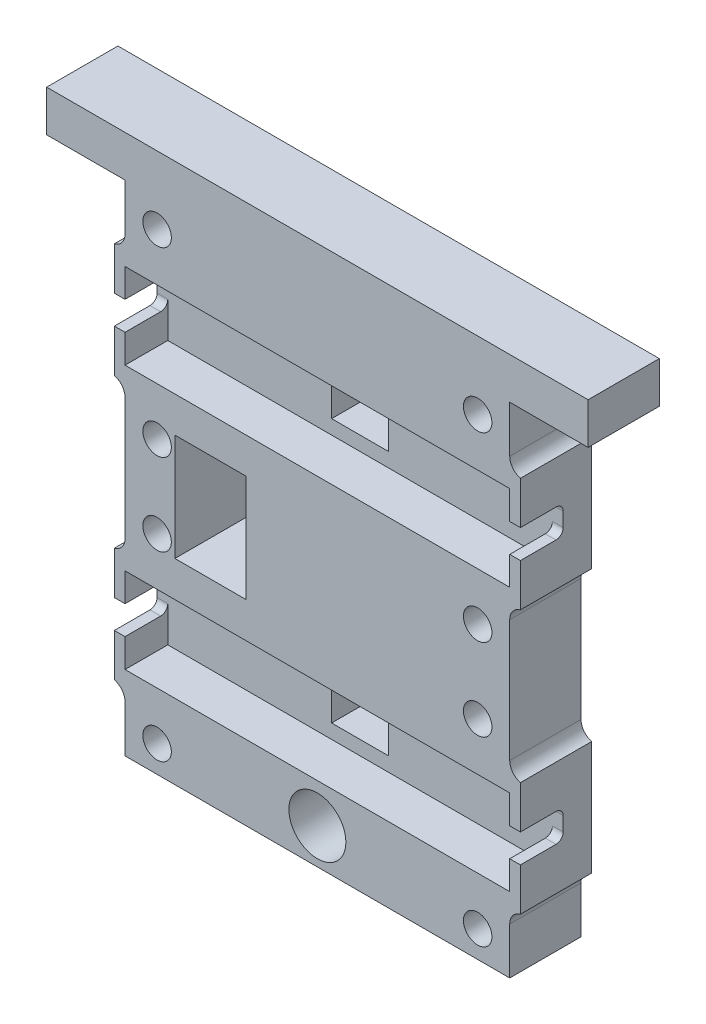
from build123d import *

# Parameters (mm, degrees)
ESBO_O1_R                = 2
ESBO_O1_R_2              = 4
RESSALTO_EXTRUS_O1_DEPTH = 10
ESBO_O7_W                = 10
ESBO_O7_H                = 15
ESBO_O7_W_2              = 8
ESBO_O7_H_2              = 8
CORTE_EXTRUS_O1_DEPTH    = 55.856129841
CORTE_EXTRUS_O7_DEPTH    = 6
FILETE1_R                = 1
FILETE2_R                = 2


with BuildPart() as part:
    # Esboço1 → Ressalto-extrusão1 (new body)
    with BuildSketch(Plane.XY):
        Polygon((-26.623119185, 32.1), (-26.623119185, 23.6), (-28.123119185, 23.6), (-28.123119185, 7.6), (-26.623119185, 7.6), (-26.623119185, -13.4), (-28.123119185, -13.4), (-28.123119185, -29.4), (-26.623119185, -29.4), (-26.623119185, -37.9), (27.376880815, -37.9), (27.376880815, -29.4), (28.876880815, -29.4), (28.876880815, -13.4), (27.376880815, -13.4), (27.376880815, 7.6), (28.876880815, 7.6), (28.876880815, 23.6), (27.376880815, 23.6), (27.376880815, 32.1), (38.376880815, 32.1), (38.376880815, 37.9), (-37.623119185, 37.9), (-37.623119185, 32.1), align=None)
        with Locations((-22.123119185, 28.35)):
            Circle(ESBO_O1_R, mode=Mode.SUBTRACT)
        with Locations((22.876880815, 28.35)):
            Circle(ESBO_O1_R, mode=Mode.SUBTRACT)
        with Locations((22.876880815, -34.15)):
            Circle(ESBO_O1_R, mode=Mode.SUBTRACT)
        with Locations((-22.123119185, -34.15)):
            Circle(ESBO_O1_R, mode=Mode.SUBTRACT)
        with Locations((-22.123119185, -8.65)):
            Circle(ESBO_O1_R, mode=Mode.SUBTRACT)
        with Locations((22.876880815, -8.65)):
            Circle(ESBO_O1_R, mode=Mode.SUBTRACT)
        with Locations((-22.123119185, 2.85)):
            Circle(ESBO_O1_R, mode=Mode.SUBTRACT)
        with Locations((22.876880815, 2.85)):
            Circle(ESBO_O1_R, mode=Mode.SUBTRACT)
        with Locations((0.376880815, -32.9)):
            Circle(ESBO_O1_R_2, mode=Mode.SUBTRACT)
    extrude(amount=RESSALTO_EXTRUS_O1_DEPTH)

    # Esboço7 → Corte-extrusão1 (cut, through all)
    with BuildSketch(Plane(origin=(0, 0, 0), x_dir=(-1, 0, 0), z_dir=(0, 0, -1))):
        with Locations((14.623119185, -2.9)):
            Rectangle(ESBO_O7_W, ESBO_O7_H)
        with Locations((-0.376880815, 15.6)):
            Rectangle(ESBO_O7_W_2, ESBO_O7_H_2)
        with Locations((-0.376880815, -21.4)):
            Rectangle(ESBO_O7_W_2, ESBO_O7_H_2)
    extrude(amount=-CORTE_EXTRUS_O1_DEPTH, mode=Mode.SUBTRACT)

    # Esboço9 → Corte-extrusão7 (cut)
    with BuildSketch(Plane.XY.offset(10)):
        Polygon((27.376880815, 9.6), (-26.623119185, 9.6), (-26.623119185, 13.6), (-28.623119185, 13.6), (-28.623119185, 17.6), (-26.623119185, 17.6), (-26.623119185, 21.6), (27.376880815, 21.6), (27.376880815, 17.6), (29.376880815, 17.6), (29.376880815, 13.6), (27.376880815, 13.6), align=None)
        Polygon((27.376880815, -15.4), (-26.623119185, -15.4), (-26.623119185, -19.4), (-28.623119185, -19.4), (-28.623119185, -23.4), (-26.623119185, -23.4), (-26.623119185, -27.4), (27.376880815, -27.4), (27.376880815, -23.4), (29.376880815, -23.4), (29.376880815, -19.4), (27.376880815, -19.4), align=None)
    extrude(amount=-CORTE_EXTRUS_O7_DEPTH, mode=Mode.SUBTRACT)

    # Filete1
    filete1_edges = [part.edges().sort_by_distance(p)[0] for p in [
        (28.126880815, 17.6, 4),
        (28.126880815, 13.6, 4),
        (-27.373119185, 13.6, 4),
        (-27.373119185, 17.6, 4),
        (28.126880815, -19.4, 4),
        (28.126880815, -23.4, 4),
        (-27.373119185, -23.4, 4),
        (-27.373119185, -19.4, 4),
    ]]
    fillet(filete1_edges, radius=FILETE1_R)

    # Filete2
    # the kernel refuses this fillet: 2 mm, written as the material it adds along each edge
    with BuildSketch(Plane(origin=(-26.623119185, 23.6, 0), x_dir=(0, 1, 0), z_dir=(0, 0, 1)), Plane(origin=(27.376880815, -29.4, 0), x_dir=(0, -1, 0), z_dir=(0, 0, 1))) as filete2_piece_1:
        with BuildLine():
            CenterArc((1.936491673, 2), FILETE2_R, 194.477512186, 75.522487814)
            Line((0, 1.5), (-0.038729833, 1.49))
            ThreePointArc((-0.038729833, 1.49), (-0.04, 0.75), (-0.04, 0))
            Line((-0.04, 0), (0, -0.04))
            Line((0, -0.04), (1.936491673, -0.04))
            Line((1.936491673, -0.04), (1.936491673, 0))
        make_face()
    extrude(amount=10)
    with BuildSketch(Plane(origin=(27.376880815, 23.6, 0), x_dir=(1, 0, 0), z_dir=(0, 0, 1)), Plane(origin=(-26.623119185, -29.4, 0), x_dir=(-1, 0, 0), z_dir=(0, 0, 1))) as filete2_piece_2:
        with BuildLine():
            CenterArc((2, 1.936491673), FILETE2_R, 180, 75.522487814)
            Line((0, 1.936491673), (-0.04, 1.936491673))
            Line((-0.04, 1.936491673), (-0.04, 0))
            Line((-0.04, 0), (0, -0.04))
            ThreePointArc((0, -0.04), (0.75, -0.04), (1.49, -0.038729833))
            Line((1.49, -0.038729833), (1.5, 0))
        make_face()
    extrude(amount=10)
    with BuildSketch(Plane(origin=(27.376880815, 7.6, 0), x_dir=(1, 0, 0), z_dir=(0, 0, 1)), Plane(origin=(-26.623119185, -13.4, 0), x_dir=(-1, 0, 0), z_dir=(0, 0, 1))) as filete2_piece_3:
        with BuildLine():
            CenterArc((2, -1.936491673), FILETE2_R, 104.477512186, 75.522487814)
            Line((0, -1.936491673), (-0.04, -1.936491673))
            Line((-0.04, -1.936491673), (-0.04, 0))
            Line((-0.04, 0), (0, 0.04))
            ThreePointArc((0, 0.04), (0.75, 0.04), (1.49, 0.038729833))
            Line((1.49, 0.038729833), (1.5, 0))
        make_face()
    extrude(amount=10)
    with BuildSketch(Plane(origin=(27.376880815, -13.4, 0), x_dir=(0, 1, 0), z_dir=(0, 0, 1)), Plane(origin=(-26.623119185, 7.6, 0), x_dir=(0, -1, 0), z_dir=(0, 0, 1))) as filete2_piece_4:
        with BuildLine():
            CenterArc((1.936491673, -2), FILETE2_R, 90, 75.522487814)
            Line((0, -1.5), (-0.038729833, -1.49))
            ThreePointArc((-0.038729833, -1.49), (-0.04, -0.75), (-0.04, 0))
            Line((-0.04, 0), (0, 0.04))
            Line((0, 0.04), (1.936491673, 0.04))
            Line((1.936491673, 0.04), (1.936491673, 0))
        make_face()
    extrude(amount=10)


solid = part.part
